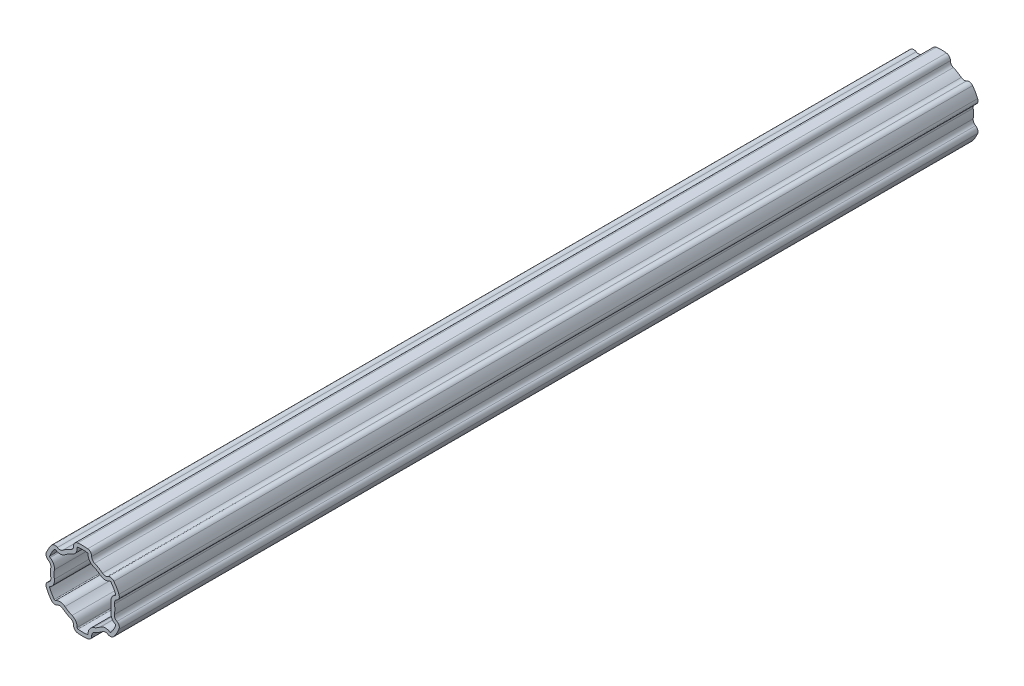
from build123d import *

# Parameters (mm, degrees)
BOSS_EXTRUDE1_DEPTH = 381


with BuildPart() as part:
    # Sketch1 → Boss-Extrude1 (new body)
    with BuildSketch(Plane.XY):
        with BuildLine():
            ThreePointArc((-5.305232227, 13.252552057), (-7.1375, 12.362512639), (-8.824430633, 11.22074191))
            ThreePointArc((-8.824430633, 11.22074191), (-9.981957879, 10.782799599), (-11.181776449, 11.08627644))
            ThreePointArc((-11.181776449, 11.08627644), (-12.622148396, 11.355295802), (-13.870578082, 10.588180375))
            ThreePointArc((-13.870578082, 10.588180375), (-15.112143296, 8.725), (-16.104922226, 6.718182797))
            ThreePointArc((-16.104922226, 6.718182797), (-16.145048829, 5.25345326), (-15.191885255, 4.140564245))
            ThreePointArc((-15.191885255, 4.140564245), (-14.329157316, 3.253229304), (-14.12966286, 2.031810147))
            ThreePointArc((-14.12966286, 2.031810147), (-14.238619356, 1.01850078), (-14.275, 0))
            ThreePointArc((-14.275, 0), (-14.238619356, -1.01850078), (-14.12966286, -2.031810147))
            ThreePointArc((-14.12966286, -2.031810147), (-14.329157316, -3.253229304), (-15.191885255, -4.140564245))
            ThreePointArc((-15.191885255, -4.140564245), (-16.145048829, -5.25345326), (-16.104922226, -6.718182797))
            ThreePointArc((-16.104922226, -6.718182797), (-15.112143296, -8.725), (-13.870578082, -10.588180375))
            ThreePointArc((-13.870578082, -10.588180375), (-12.622148396, -11.355295802), (-11.181776449, -11.08627644))
            ThreePointArc((-11.181776449, -11.08627644), (-9.981957879, -10.782799599), (-8.824430633, -11.22074191))
            ThreePointArc((-8.824430633, -11.22074191), (-7.1375, -12.362512639), (-5.305232227, -13.252552057))
            ThreePointArc((-5.305232227, -13.252552057), (-4.347199437, -14.036028902), (-4.010108806, -15.226840684))
            ThreePointArc((-4.010108806, -15.226840684), (-3.522900434, -16.608749062), (-2.234344144, -17.306363172))
            ThreePointArc((-2.234344144, -17.306363172), (0, -17.45), (2.234344144, -17.306363172))
            ThreePointArc((2.234344144, -17.306363172), (3.503647323, -16.630968906), (4.010957256, -15.285634521))
            ThreePointArc((4.010957256, -15.285634521), (4.010745132, -15.256234542), (4.010108806, -15.226840684))
            ThreePointArc((4.010108806, -15.226840684), (4.009464671, -15.197086165), (4.009249945, -15.167325448))
            ThreePointArc((4.009249945, -15.167325448), (4.363702952, -14.011262386), (5.305232227, -13.252552057))
            ThreePointArc((5.305232227, -13.252552057), (7.1375, -12.362512639), (8.824430633, -11.22074191))
            ThreePointArc((8.824430633, -11.22074191), (9.981957879, -10.782799599), (11.181776449, -11.08627644))
            ThreePointArc((11.181776449, -11.08627644), (12.622148396, -11.355295802), (13.870578082, -10.588180375))
            ThreePointArc((13.870578082, -10.588180375), (15.112143296, -8.725), (16.104922226, -6.718182797))
            ThreePointArc((16.104922226, -6.718182797), (16.2223271, -6.333751864), (16.261976436, -5.933753144))
            ThreePointArc((16.261976436, -5.933753144), (15.974119502, -4.889648077), (15.191885255, -4.140564245))
            ThreePointArc((15.191885255, -4.140564245), (14.400052997, -3.382289157), (14.10866406, -2.325372926))
            ThreePointArc((14.10866406, -2.325372926), (14.113920458, -2.1782165), (14.12966286, -2.031810147))
            ThreePointArc((14.12966286, -2.031810147), (14.275, 0), (14.12966286, 2.031810147))
            ThreePointArc((14.12966286, 2.031810147), (14.113920458, 2.1782165), (14.10866406, 2.325372926))
            ThreePointArc((14.10866406, 2.325372926), (14.400052997, 3.382289157), (15.191885255, 4.140564245))
            ThreePointArc((15.191885255, 4.140564245), (15.974119502, 4.889648077), (16.261976436, 5.933753144))
            ThreePointArc((16.261976436, 5.933753144), (16.2223271, 6.333751864), (16.104922226, 6.718182797))
            ThreePointArc((16.104922226, 6.718182797), (15.112143296, 8.725), (13.870578082, 10.588180375))
            ThreePointArc((13.870578082, 10.588180375), (12.622148396, 11.355295802), (11.181776449, 11.08627644))
            ThreePointArc((11.181776449, 11.08627644), (9.981957879, 10.782799599), (8.824430633, 11.22074191))
            ThreePointArc((8.824430633, 11.22074191), (7.1375, 12.362512639), (5.305232227, 13.252552057))
            ThreePointArc((5.305232227, 13.252552057), (4.363702952, 14.011262386), (4.009249945, 15.167325448))
            ThreePointArc((4.009249945, 15.167325448), (4.009464671, 15.197086165), (4.010108806, 15.226840684))
            ThreePointArc((4.010108806, 15.226840684), (4.010745132, 15.256234542), (4.010957256, 15.285634521))
            ThreePointArc((4.010957256, 15.285634521), (3.503647323, 16.630968906), (2.234344144, 17.306363172))
            ThreePointArc((2.234344144, 17.306363172), (0, 17.45), (-2.234344144, 17.306363172))
            ThreePointArc((-2.234344144, 17.306363172), (-3.522900434, 16.608749062), (-4.010108806, 15.226840684))
            ThreePointArc((-4.010108806, 15.226840684), (-4.347199437, 14.036028902), (-5.305232227, 13.252552057))
        make_face()
        with BuildLine():
            ThreePointArc((-4.715245806, 11.778756863), (-6.34375, 10.987697311), (-7.843079766, 9.972901084))
            ThreePointArc((-7.843079766, 9.972901084), (-9.891552176, 9.197875923), (-12.014867411, 9.734937956))
            ThreePointArc((-12.014867411, 9.734937956), (-12.332986369, 9.794353275), (-12.608713171, 9.624929009))
            ThreePointArc((-12.608713171, 9.624929009), (-13.737327968, 7.93125), (-14.639789617, 6.107001411))
            ThreePointArc((-14.639789617, 6.107001411), (-14.648651934, 5.783502863), (-14.438137279, 5.537711424))
            ThreePointArc((-14.438137279, 5.537711424), (-12.911370298, 3.967397506), (-12.558325571, 1.805855779))
            ThreePointArc((-12.558325571, 1.805855779), (-12.655165189, 0.905234932), (-12.6875, 0))
            ThreePointArc((-12.6875, 0), (-12.655165189, -0.905234932), (-12.558325571, -1.805855779))
            ThreePointArc((-12.558325571, -1.805855779), (-12.911370298, -3.967397506), (-14.438137279, -5.537711424))
            ThreePointArc((-14.438137279, -5.537711424), (-14.648651934, -5.783502863), (-14.639789617, -6.107001411))
            ThreePointArc((-14.639789617, -6.107001411), (-13.737327968, -7.93125), (-12.608713171, -9.624929009))
            ThreePointArc((-12.608713171, -9.624929009), (-12.332986369, -9.794353275), (-12.014867411, -9.734937956))
            ThreePointArc((-12.014867411, -9.734937956), (-9.891552176, -9.197875923), (-7.843079766, -9.972901084))
            ThreePointArc((-7.843079766, -9.972901084), (-6.34375, -10.987697311), (-4.715245806, -11.778756863))
            ThreePointArc((-4.715245806, -11.778756863), (-3.019818122, -13.165273429), (-2.423269868, -15.272649379))
            ThreePointArc((-2.423269868, -15.272649379), (-2.315665565, -15.577856137), (-2.031076446, -15.731930419))
            ThreePointArc((-2.031076446, -15.731930419), (0, -15.8625), (2.031076446, -15.731930419))
            ThreePointArc((2.031076446, -15.731930419), (2.311413344, -15.582763588), (2.423457256, -15.285634521))
            ThreePointArc((2.423457256, -15.285634521), (2.423410406, -15.279141274), (2.423269868, -15.272649379))
            ThreePointArc((2.423269868, -15.272649379), (2.422129945, -15.219992897), (2.421749945, -15.167325448))
            ThreePointArc((2.421749945, -15.167325448), (3.049024342, -13.1214442), (4.715245806, -11.778756863))
            ThreePointArc((4.715245806, -11.778756863), (6.34375, -10.987697311), (7.843079766, -9.972901084))
            ThreePointArc((7.843079766, -9.972901084), (9.891552176, -9.197875923), (12.014867411, -9.734937956))
            ThreePointArc((12.014867411, -9.734937956), (12.332986369, -9.794353275), (12.608713171, -9.624929009))
            ThreePointArc((12.608713171, -9.624929009), (13.737327968, -7.93125), (14.639789617, -6.107001411))
            ThreePointArc((14.639789617, -6.107001411), (14.665719527, -6.022096419), (14.674476436, -5.933753144))
            ThreePointArc((14.674476436, -5.933753144), (14.610900672, -5.703153252), (14.438137279, -5.537711424))
            ThreePointArc((14.438137279, -5.537711424), (13.036834166, -4.195794332), (12.52116406, -2.325372926))
            ThreePointArc((12.52116406, -2.325372926), (12.530466291, -2.064950652), (12.558325571, -1.805855779))
            ThreePointArc((12.558325571, -1.805855779), (12.6875, 0), (12.558325571, 1.805855779))
            ThreePointArc((12.558325571, 1.805855779), (12.530466291, 2.064950652), (12.52116406, 2.325372926))
            ThreePointArc((12.52116406, 2.325372926), (13.036834166, 4.195794332), (14.438137279, 5.537711424))
            ThreePointArc((14.438137279, 5.537711424), (14.610900672, 5.703153252), (14.674476436, 5.933753144))
            ThreePointArc((14.674476436, 5.933753144), (14.665719527, 6.022096419), (14.639789617, 6.107001411))
            ThreePointArc((14.639789617, 6.107001411), (13.737327968, 7.93125), (12.608713171, 9.624929009))
            ThreePointArc((12.608713171, 9.624929009), (12.332986369, 9.794353275), (12.014867411, 9.734937956))
            ThreePointArc((12.014867411, 9.734937956), (9.891552176, 9.197875923), (7.843079766, 9.972901084))
            ThreePointArc((7.843079766, 9.972901084), (6.34375, 10.987697311), (4.715245806, 11.778756863))
            ThreePointArc((4.715245806, 11.778756863), (3.049024342, 13.1214442), (2.421749945, 15.167325448))
            ThreePointArc((2.421749945, 15.167325448), (2.422129945, 15.219992897), (2.423269868, 15.272649379))
            ThreePointArc((2.423269868, 15.272649379), (2.423410406, 15.279141274), (2.423457256, 15.285634521))
            ThreePointArc((2.423457256, 15.285634521), (2.311413344, 15.582763588), (2.031076446, 15.731930419))
            ThreePointArc((2.031076446, 15.731930419), (0, 15.8625), (-2.031076446, 15.731930419))
            ThreePointArc((-2.031076446, 15.731930419), (-2.315665565, 15.577856137), (-2.423269868, 15.272649379))
            ThreePointArc((-2.423269868, 15.272649379), (-3.019818122, 13.165273429), (-4.715245806, 11.778756863))
        make_face(mode=Mode.SUBTRACT)
    extrude(amount=BOSS_EXTRUDE1_DEPTH)


solid = part.part
